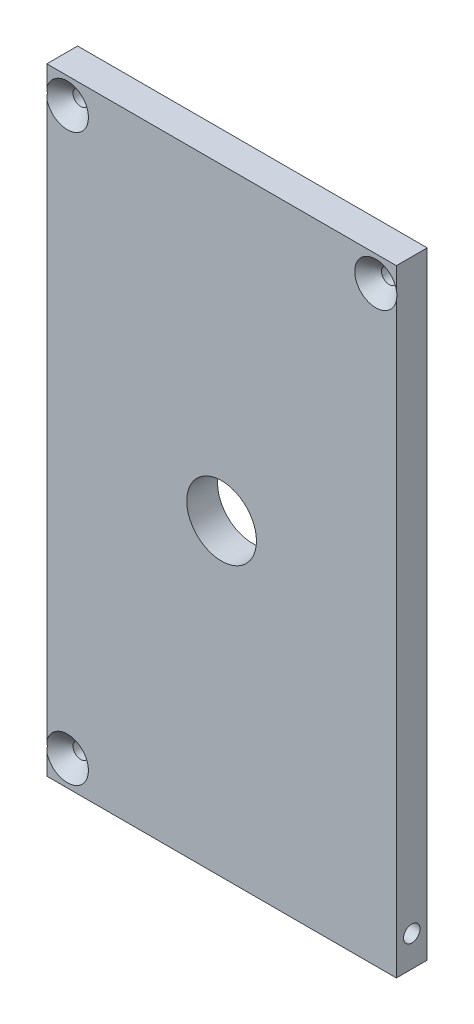
from build123d import *

# Parameters (mm, degrees)
SKETCH1_W           = 34
SKETCH1_H           = 60
SKETCH1_R           = 3.39
SKETCH1_R_2         = 0.75
BOSS_EXTRUDE1_DEPTH = 3
CHAMFER1_SIZE       = 1.3
SKETCH2_R           = 0.8
CUT_EXTRUDE1_DEPTH  = 3


with BuildPart() as part:
    # Sketch1 → Boss-Extrude1 (new body)
    with BuildSketch(Plane.XY):
        Rectangle(SKETCH1_W, SKETCH1_H)
        Circle(SKETCH1_R, mode=Mode.SUBTRACT)
        with Locations((-15, -27.5)):
            Circle(SKETCH1_R_2, mode=Mode.SUBTRACT)
        with Locations(Location((-15, 27.5, 0), (0, 0, 180))):
            Circle(SKETCH1_R_2, mode=Mode.SUBTRACT)
        with Locations((15, 27.5)):
            Circle(SKETCH1_R_2, mode=Mode.SUBTRACT)
    extrude(amount=BOSS_EXTRUDE1_DEPTH)

    # Chamfer1
    # the kernel refuses this chamfer: 1.3 mm, written as the material it takes off along each edge
    with BuildSketch(Plane(origin=(-15, -27.5, 3), x_dir=(1, 0, 0), z_dir=(0, -1, 0))) as chamfer1_piece_1:
        Polygon((0.75, -CHAMFER1_SIZE), (0.75 + CHAMFER1_SIZE, 0), (0.75, 0), align=None)
    revolve(axis=Axis((-15, -27.5, 3), (0, 0, 1)), mode=Mode.SUBTRACT)
    with BuildSketch(Plane(origin=(-15, 27.5, 3), x_dir=(-1, 0, 0), z_dir=(0, 1, 0))) as chamfer1_piece_2:
        Polygon((0.75, -CHAMFER1_SIZE), (0.75 + CHAMFER1_SIZE, 0), (0.75, 0), align=None)
    revolve(axis=Axis((-15, 27.5, 3), (0, 0, 1)), mode=Mode.SUBTRACT)
    with BuildSketch(Plane(origin=(15, 27.5, 3), x_dir=(1, 0, 0), z_dir=(0, -1, 0))) as chamfer1_piece_3:
        Polygon((0.75, -CHAMFER1_SIZE), (0.75 + CHAMFER1_SIZE, 0), (0.75, 0), align=None)
    revolve(axis=Axis((15, 27.5, 3), (0, 0, 1)), mode=Mode.SUBTRACT)

    # Sketch2 → Cut-Extrude1 (cut)
    with BuildSketch(Plane(origin=(17, 0, 0), x_dir=(0, 0, -1), z_dir=(1, 0, 0))):
        with Locations((-1.5, -27)):
            Circle(SKETCH2_R)
    extrude(amount=-CUT_EXTRUDE1_DEPTH, mode=Mode.SUBTRACT)


solid = part.part
